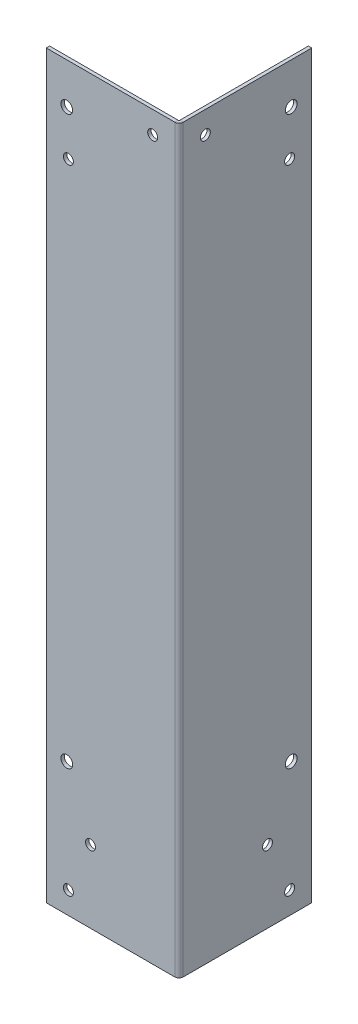
from build123d import *

# Parameters (mm, degrees)
SKETCH1_W                    = 60
SKETCH1_H                    = 334.61392
BASE_FLANGE1_DEPTH           = 1.51892
EDGE_FLANGE1_STRIP_W         = 6.83768
EDGE_FLANGE1_STRIP_H         = 1.51892
EDGE_FLANGE1_STRIP_CUT_DEPTH = 334.61392
EDGE_FLANGE1_DEPTH           = 334.61392
M5_CLEARANCE_HOLE1_D         = 5.3
M5_CLEARANCE_HOLE2_D         = 5.3
M4_CLEARANCE_HOLE1_D         = 4.5
M4_CLEARANCE_HOLE2_D         = 4.5


# Sheet-metal steps are written as plain solids
with BuildPart() as part:
    # Sketch1 → Base-Flange1 (new body)
    with BuildSketch(Plane(origin=(0, 0, 0), x_dir=(0, 0, -1), z_dir=(1, 0, 0))):
        with Locations((-30, 167.30696)):
            Rectangle(SKETCH1_W, SKETCH1_H)
    extrude(amount=-BASE_FLANGE1_DEPTH)

    # Edge-Flange1 strip (across the edge) → Edge-Flange1 strip cut (cut)
    with BuildSketch(Plane(origin=(-1.51892, 0, 60), x_dir=(0, 0, -1), z_dir=(0, 1, 0))):
        with Locations((-1.51892, -0.75946)):
            Rectangle(EDGE_FLANGE1_STRIP_W, EDGE_FLANGE1_STRIP_H)
    extrude(amount=EDGE_FLANGE1_STRIP_CUT_DEPTH, mode=Mode.SUBTRACT)

    # Edge-Flange1 section (across the edge) → Edge-Flange1 (add)
    with BuildSketch(Plane(origin=(-1.51892, 0, 60), x_dir=(0, 0, -1), z_dir=(0, 1, 0))):
        with BuildLine():
            Line((0, 0.381), (0, 58.48108))
            Line((0, 58.48108), (1.51892, 58.48108))
            Line((1.51892, 58.48108), (1.51892, 0.381))
            ThreePointArc((1.51892, 0.381), (1.630512316, 0.111592316), (1.89992, 0))
            Line((1.89992, 0), (1.89992, -1.51892))
            ThreePointArc((1.89992, -1.51892), (0.556473684, -0.962446316), (0, 0.381))
        make_face()
    extrude(amount=EDGE_FLANGE1_DEPTH)

    # M5 Clearance Hole1 (through all)
    with Locations(Plane.XY.offset(60)):
        with Locations((-50.726027, 60), (-50.726027, 316.13284)):
            Hole(M5_CLEARANCE_HOLE1_D / 2)

    # M5 Clearance Hole2 (through all)
    with Locations(Plane(origin=(0, 0, 0), x_dir=(0, 0, -1), z_dir=(1, 0, 0))):
        with Locations((-9.273973, 60), (-9.273973, 316.13284)):
            Hole(M5_CLEARANCE_HOLE2_D / 2)

    # M4 Clearance Hole1 (through all)
    with Locations(Plane.XY.offset(60)):
        with Locations((-50, 296.13284), (-11.89992, 324.61392), (-50, 10), (-40, 32.714)):
            Hole(M4_CLEARANCE_HOLE1_D / 2)

    # M4 Clearance Hole2 (through all)
    with Locations(Plane(origin=(0, 0, 0), x_dir=(0, 0, -1), z_dir=(1, 0, 0))):
        with Locations((-10, 296.13284), (-48.10008, 324.61392), (-10, 10), (-20, 32.714)):
            Hole(M4_CLEARANCE_HOLE2_D / 2)


solid = part.part
